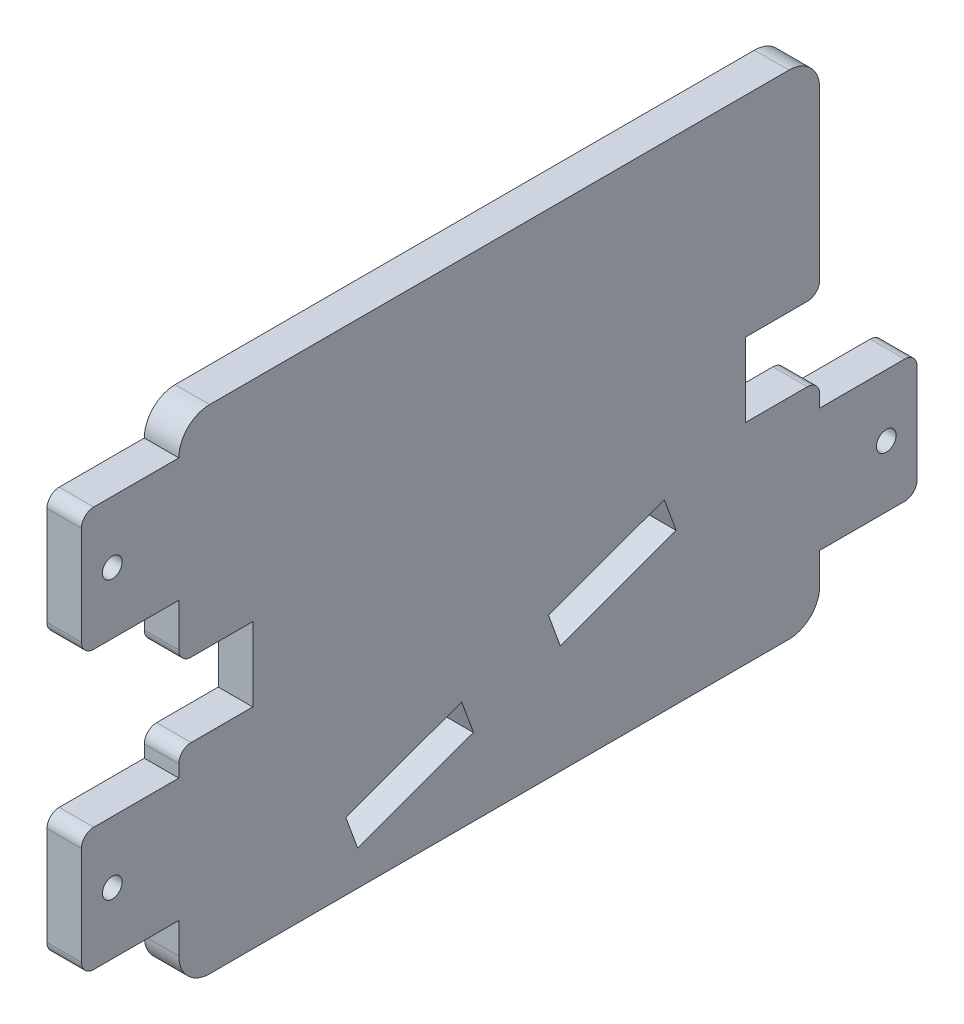
from build123d import *

# Parameters (mm, degrees)
SKETCH_1_W          = 104
SKETCH_1_H          = 80
SKETCH_1_W_2        = 15.8
SKETCH_1_H_2        = 20
SKETCH_1_R          = 1.6
EXTRUDE_1_DEPTH     = 5.6
FILLET_1_R          = 5
CUT_EXTRUDE_1_DEPTH = 79.918945761
SKETCH_4_W          = 12
SKETCH_4_H          = 12
CUT_EXTRUDE_2_DEPTH = 79.918945761
FILLET_2_R          = 2


with BuildPart() as part:
    # ｽｹｯﾁ1 → ﾎﾞｽ - 押し出し1 (new body)
    # profile 1 of 4: a face of its own
    with BuildSketch(Plane(origin=(0, 0, 0), x_dir=(0, 0, -1), z_dir=(1, 0, 0))):
        Rectangle(SKETCH_1_W, SKETCH_1_H)
    # profile 2 of 4: a face of its own
    with BuildSketch(Plane(origin=(0, 0, 0), x_dir=(0, 0, -1), z_dir=(1, 0, 0))):
        with Locations((-59.9, 25)):
            Rectangle(SKETCH_1_W_2, SKETCH_1_H_2)
        with Locations((-62.8, 25)):
            Circle(SKETCH_1_R, mode=Mode.SUBTRACT)
    # profile 3 of 4: a face of its own
    with BuildSketch(Plane(origin=(0, 0, 0), x_dir=(0, 0, -1), z_dir=(1, 0, 0))):
        with Locations((59.9, -20)):
            Rectangle(SKETCH_1_W_2, SKETCH_1_H_2)
        with Locations((62.8, -20)):
            Circle(SKETCH_1_R, mode=Mode.SUBTRACT)
    # profile 4 of 4: a face of its own
    with BuildSketch(Plane(origin=(0, 0, 0), x_dir=(0, 0, -1), z_dir=(1, 0, 0))):
        with Locations((-59.9, -20)):
            Rectangle(SKETCH_1_W_2, SKETCH_1_H_2)
        with Locations((-62.8, -20)):
            Circle(SKETCH_1_R, mode=Mode.SUBTRACT)
    extrude(amount=EXTRUDE_1_DEPTH)

    # ﾌｨﾚｯﾄ1
    fillet_1_edges = [part.edges().sort_by_distance(p)[0] for p in [
        (2.8, -40, -52),
        (2.8, -40, 52),
        (2.8, 40, 52),
        (2.8, 40, -52),
    ]]
    fillet(fillet_1_edges, radius=FILLET_1_R - 0.0001)  # a hair under: the kernel refuses the full size

    # ｽｹｯﾁ3 → ｶｯﾄ - 押し出し1 (cut, through all)
    with BuildSketch(Plane(origin=(5.6, 0, 0), x_dir=(0, 0, -1), z_dir=(1, 0, 0))):
        Polygon((-24.896207629, -29.079798567), (-6.102355213, -22.2393957), (-4.187042411, -27.501674377), (-22.980894827, -34.342077243), align=None)
        Polygon((7.993034098, -17.10909355), (26.786886514, -10.268690684), (28.702199317, -15.53096936), (9.908346901, -22.371372227), align=None)
    extrude(amount=-CUT_EXTRUDE_1_DEPTH, mode=Mode.SUBTRACT)

    # ｽｹｯﾁ4 → ｶｯﾄ - 押し出し2 (cut, through all)
    with BuildSketch(Plane(origin=(5.6, 0, 0), x_dir=(0, 0, -1), z_dir=(1, 0, 0))):
        with Locations((-46, 0)):
            Rectangle(SKETCH_4_W, SKETCH_4_H)
        with Locations((46, 0)):
            Rectangle(SKETCH_4_W, SKETCH_4_H)
    extrude(amount=-CUT_EXTRUDE_2_DEPTH, mode=Mode.SUBTRACT)

    # ﾌｨﾚｯﾄ2
    fillet_2_edges = [part.edges().sort_by_distance(p)[0] for p in [
        (2.8, -6, 52),
        (2.8, 6, 52),
        (2.8, 6, -52),
        (2.8, -6, -52),
        (2.8, -10, -67.8),
        (2.8, -30, -67.8),
        (2.8, -30, 67.8),
        (2.8, -10, 67.8),
        (2.8, 15, 67.8),
        (2.8, 35, 67.8),
    ]]
    fillet(fillet_2_edges, radius=FILLET_2_R)


solid = part.part
